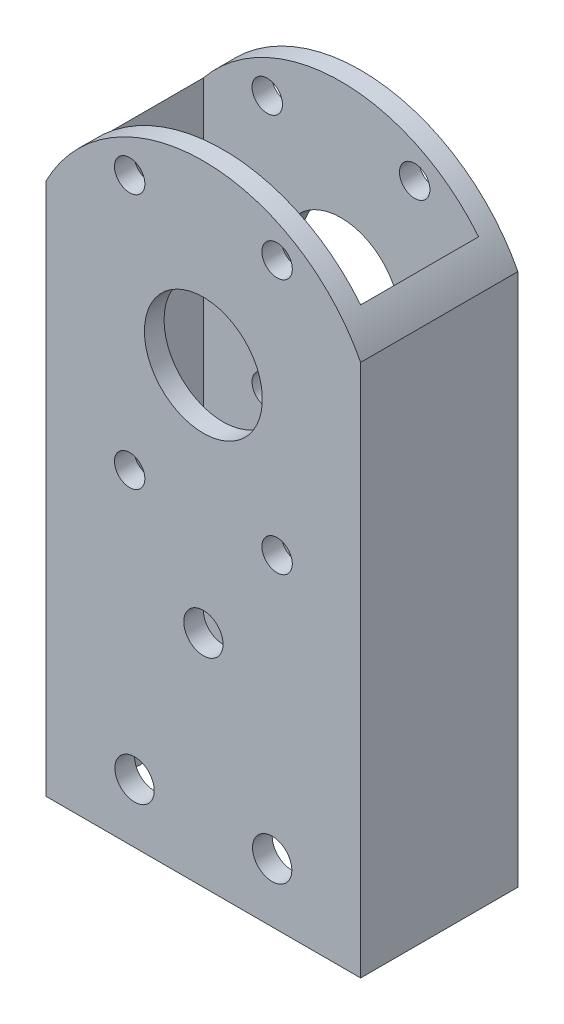
from build123d import *

# Parameters (mm, degrees)
SKETCH1_W                    = 50.8
SKETCH1_H                    = 25.4
SKETCH1_W_2                  = 44.45
SKETCH1_H_2                  = 19.05
EXTRUDE_THIN1_DEPTH          = 101.6
F_10_0_1935_DIAMETER_HOLE2_D = 4.9149
CUT_EXTRUDE2_DEPTH           = 108.763073453
CUT_EXTRUDE2_DEPTH_BACK      = 108.763073453
SKETCH7_R                    = 9.525
F_1_4_0_25_DIAMETER_HOLE1_D  = 6.35
CUT_EXTRUDE3_DEPTH           = 108.763073453
F_1_4_0_25_DIAMETER_HOLE2_D  = 6.35


with BuildPart() as part:
    # Sketch1 → Extrude-Thin1 (new body)
    with BuildSketch(Plane(origin=(0, 0, 0), x_dir=(1, 0, 0), z_dir=(0, 1, 0))):
        Rectangle(SKETCH1_W, SKETCH1_H)
        Rectangle(SKETCH1_W_2, SKETCH1_H_2, mode=Mode.SUBTRACT)
    extrude(amount=EXTRUDE_THIN1_DEPTH)

    # #10 (0.1935) Diameter Hole2 (through all)
    with Locations(Plane(origin=(0, 0, -12.7), x_dir=(-1, 0, 0), z_dir=(0, 0, -1))):
        with Locations((-11.90625, 52.402770072), (-11.90625, 93.647229928), (11.90625, 93.647229928), (11.90625, 52.402770072)):
            Hole(F_10_0_1935_DIAMETER_HOLE2_D / 2)

    # Sketch7 → Cut-Extrude2 (cut, two sides: drawn at the far end of the back side and taken through both)
    with BuildSketch(Plane(origin=(0, 0, -12.7), x_dir=(-1, 0, 0), z_dir=(0, 0, -1)).offset(-CUT_EXTRUDE2_DEPTH_BACK)):
        with Locations((0, 73.025)):
            Circle(SKETCH7_R)
    extrude(amount=CUT_EXTRUDE2_DEPTH + CUT_EXTRUDE2_DEPTH_BACK, mode=Mode.SUBTRACT)

    # 1/4 (0.25) Diameter Hole1 (through all)
    with Locations(Plane.XY.offset(12.7)):
        with Locations((-11.1125, 9.525), (11.1125, 9.525), (-109.171479686, 68.785430569)):
            Hole(F_1_4_0_25_DIAMETER_HOLE1_D / 2)

    # Sketch10 → Cut-Extrude3 (cut, through all)
    with BuildSketch(Plane(origin=(0, 0, -12.7), x_dir=(-1, 0, 0), z_dir=(0, 0, -1))):
        with BuildLine():
            Line((25.4, 101.6), (0, 101.6))
            ThreePointArc((0, 101.6), (14.873790542, 97.423790542), (25.4, 86.115860361))
            Line((25.4, 86.115860361), (25.4, 101.6))
        make_face()
        with BuildLine():
            Line((-25.4, 101.6), (-25.4, 86.115860361))
            ThreePointArc((-25.4, 86.115860361), (-14.873790542, 97.423790542), (0, 101.6))
            Line((0, 101.6), (-25.4, 101.6))
        make_face()
    extrude(amount=-CUT_EXTRUDE3_DEPTH, mode=Mode.SUBTRACT)

    # 1/4 (0.25) Diameter Hole2 (through all)
    with Locations(Plane.XY.offset(12.7)):
        with Locations((0, 35.56)):
            Hole(F_1_4_0_25_DIAMETER_HOLE2_D / 2)


solid = part.part
